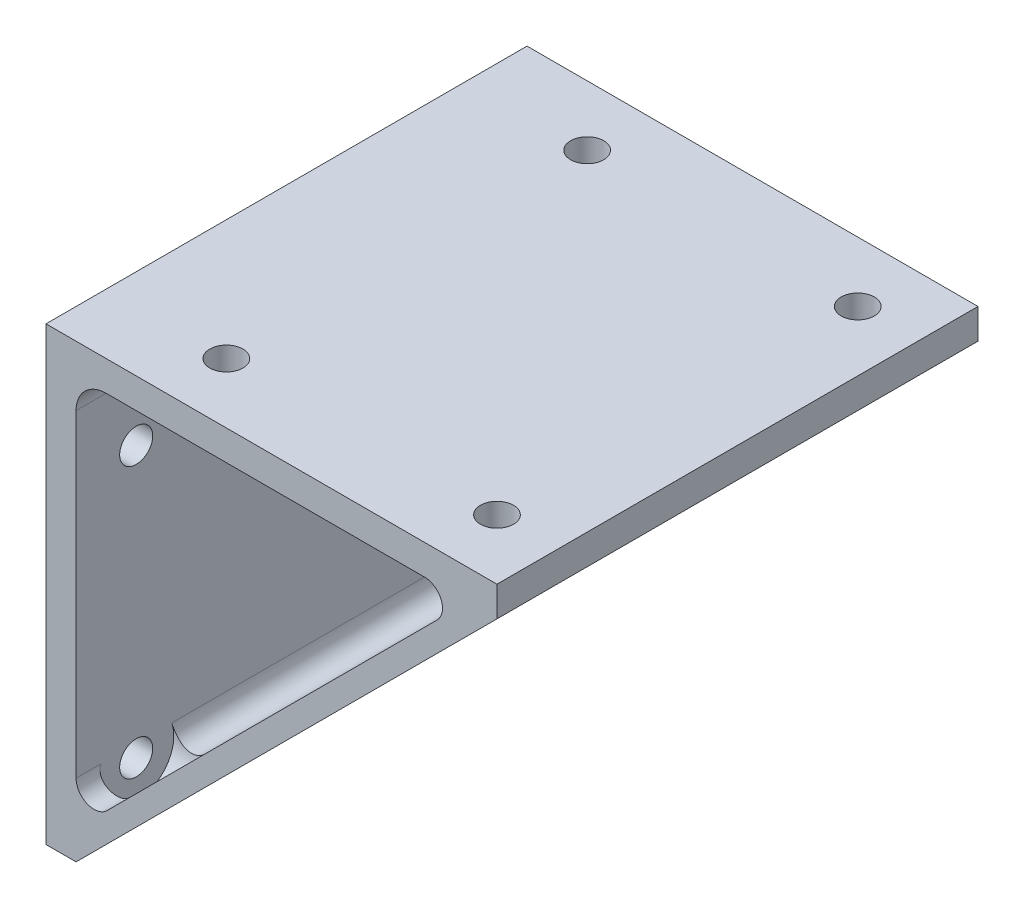
from build123d import *

# Parameters (mm, degrees)
BOSS_EXTRU_1_DEPTH      = 80
CONG_1_R                = 3
CONG_2_R                = 5
ENL_V_MAT_EXTRU_1_REACH = 119.218
ESQUISSE2_R             = 2.75
ENL_V_MAT_EXTRU_2_REACH = 116.084
ESQUISSE3_R             = 6.25
ENL_V_MAT_EXTRU_3_REACH = 125.629
ESQUISSE4_R             = 2.75
ENL_V_MAT_EXTRU_4_REACH = 122.661
ESQUISSE5_R             = 6.25
ENL_V_START             = -3.408092413
ENL_V_MAT_EXTRU_5_DEPTH = 3.408092413


# Read off the part's stored shape, not the designer's step: Enlèv. mat.-Extru.5
with BuildPart() as part:
    # Esquisse1 → Boss.-Extru.1 (new body)
    with BuildSketch(Plane.XY):
        Polygon((-33.585720943, 17.910660079), (-33.585720943, -57.089339921), (-28.585720943, -57.089339921), (41.414279057, 12.910660079), (41.414279057, 17.910660079), align=None)
        Polygon((-28.585720943, -52.269569409), (-28.585720943, 12.910660079), (36.594508545, 12.910660079), align=None, mode=Mode.SUBTRACT)
    extrude(amount=BOSS_EXTRU_1_DEPTH)

    # Congé1
    cong_1_edges = [part.edges().sort_by_distance(p)[0] for p in [
        (-28.585720943, -52.269569409, 40),
        (36.594508545, 12.910660079, 40),
    ]]
    fillet(cong_1_edges, radius=CONG_1_R)

    # Congé2
    cong_2_edges = [part.edges().sort_by_distance(p)[0] for p in [
        (-28.585720943, 12.910660079, 40),
    ]]
    fillet(cong_2_edges, radius=CONG_2_R)

    # Esquisse2 → Enlèv. mat.-Extru.1 (cut, up to next)
    with BuildSketch(Plane(origin=(0, 17.910660079, 0), x_dir=(1, 0, 0), z_dir=(0, 1, 0)), mode=Mode.PRIVATE) as enl_v_mat_extru_1_sk1:
        with Locations(Location((-13.585720943, -10, 0), (0, 0, 180))):
            Circle(ESQUISSE2_R)
    enl_v_mat_extru_1_tool1 = extrude(enl_v_mat_extru_1_sk1.sketch, amount=-ENL_V_MAT_EXTRU_1_REACH, mode=Mode.PRIVATE) & part.part
    # Esquisse2 → Enlèv. mat.-Extru.1 (cut, up to next)
    with BuildSketch(Plane(origin=(0, 17.910660079, 0), x_dir=(1, 0, 0), z_dir=(0, 1, 0)), mode=Mode.PRIVATE) as enl_v_mat_extru_1_sk2:
        with Locations(Location((31.414279057, -10, 0), (0, 0, 180))):
            Circle(ESQUISSE2_R)
    enl_v_mat_extru_1_tool2 = extrude(enl_v_mat_extru_1_sk2.sketch, amount=-ENL_V_MAT_EXTRU_1_REACH, mode=Mode.PRIVATE) & part.part
    # Esquisse2 → Enlèv. mat.-Extru.1 (cut, up to next)
    with BuildSketch(Plane(origin=(0, 17.910660079, 0), x_dir=(1, 0, 0), z_dir=(0, 1, 0)), mode=Mode.PRIVATE) as enl_v_mat_extru_1_sk3:
        with Locations(Location((31.414279057, -70, 0), (0, 0, 180))):
            Circle(ESQUISSE2_R)
    enl_v_mat_extru_1_tool3 = extrude(enl_v_mat_extru_1_sk3.sketch, amount=-ENL_V_MAT_EXTRU_1_REACH, mode=Mode.PRIVATE) & part.part
    # Esquisse2 → Enlèv. mat.-Extru.1 (cut, up to next)
    with BuildSketch(Plane(origin=(0, 17.910660079, 0), x_dir=(1, 0, 0), z_dir=(0, 1, 0)), mode=Mode.PRIVATE) as enl_v_mat_extru_1_sk4:
        with Locations(Location((-13.585720943, -70, 0), (0, 0, 180))):
            Circle(ESQUISSE2_R)
    enl_v_mat_extru_1_tool4 = extrude(enl_v_mat_extru_1_sk4.sketch, amount=-ENL_V_MAT_EXTRU_1_REACH, mode=Mode.PRIVATE) & part.part
    add(enl_v_mat_extru_1_tool1.solids().sort_by_distance((-13.585721, 17.91066, 10))[0], mode=Mode.SUBTRACT)
    add(enl_v_mat_extru_1_tool2.solids().sort_by_distance((31.414279, 17.91066, 10))[0], mode=Mode.SUBTRACT)
    add(enl_v_mat_extru_1_tool3.solids().sort_by_distance((31.414279, 17.91066, 70))[0], mode=Mode.SUBTRACT)
    add(enl_v_mat_extru_1_tool4.solids().sort_by_distance((-13.585721, 17.91066, 70))[0], mode=Mode.SUBTRACT)

    # Enlèv. mat.-Extru.2: up to this plane
    enl_v_mat_extru_2_end = Plane(origin=(-28.585720943, -57.089339921, 80), z_dir=(-0.7071067811865477, 0.7071067811865474, 0))
    # Esquisse3 → Enlèv. mat.-Extru.2 (cut, up to the surface)
    with BuildSketch(Plane.XZ.offset(-12.910660079), mode=Mode.PRIVATE) as enl_v_mat_extru_2_sk1:
        with Locations((-13.585720943, 10)):
            Circle(ESQUISSE3_R)
    enl_v_mat_extru_2_tool1 = split(extrude(enl_v_mat_extru_2_sk1.sketch, amount=ENL_V_MAT_EXTRU_2_REACH, mode=Mode.PRIVATE), bisect_by=enl_v_mat_extru_2_end, keep=Keep.BOTH, mode=Mode.PRIVATE)
    add(enl_v_mat_extru_2_tool1.solids().sort_by_distance((-13.585721, 12.91066, 10))[0], mode=Mode.SUBTRACT)
    # Esquisse3 → Enlèv. mat.-Extru.2 (cut, up to the surface)
    with BuildSketch(Plane.XZ.offset(-12.910660079), mode=Mode.PRIVATE) as enl_v_mat_extru_2_sk2:
        with Locations((-13.585720943, 70)):
            Circle(ESQUISSE3_R)
    enl_v_mat_extru_2_tool2 = split(extrude(enl_v_mat_extru_2_sk2.sketch, amount=ENL_V_MAT_EXTRU_2_REACH, mode=Mode.PRIVATE), bisect_by=enl_v_mat_extru_2_end, keep=Keep.BOTH, mode=Mode.PRIVATE)
    add(enl_v_mat_extru_2_tool2.solids().sort_by_distance((-13.585721, 12.91066, 70))[0], mode=Mode.SUBTRACT)
    # Esquisse3 → Enlèv. mat.-Extru.2 (cut, up to the surface)
    with BuildSketch(Plane.XZ.offset(-12.910660079), mode=Mode.PRIVATE) as enl_v_mat_extru_2_sk3:
        with Locations(Location((31.414279057, 10, 0), (0, 0, 109.267913115))):
            Circle(ESQUISSE3_R)
    enl_v_mat_extru_2_tool3 = split(extrude(enl_v_mat_extru_2_sk3.sketch, amount=ENL_V_MAT_EXTRU_2_REACH, mode=Mode.PRIVATE), bisect_by=enl_v_mat_extru_2_end, keep=Keep.BOTH, mode=Mode.PRIVATE)
    add(enl_v_mat_extru_2_tool3.solids().sort_by_distance((31.414279, 12.91066, 10))[0], mode=Mode.SUBTRACT)
    # Esquisse3 → Enlèv. mat.-Extru.2 (cut, up to the surface)
    with BuildSketch(Plane.XZ.offset(-12.910660079), mode=Mode.PRIVATE) as enl_v_mat_extru_2_sk4:
        with Locations(Location((31.414279057, 70, 0), (0, 0, 109.267913115))):
            Circle(ESQUISSE3_R)
    enl_v_mat_extru_2_tool4 = split(extrude(enl_v_mat_extru_2_sk4.sketch, amount=ENL_V_MAT_EXTRU_2_REACH, mode=Mode.PRIVATE), bisect_by=enl_v_mat_extru_2_end, keep=Keep.BOTH, mode=Mode.PRIVATE)
    add(enl_v_mat_extru_2_tool4.solids().sort_by_distance((31.414279, 12.91066, 70))[0], mode=Mode.SUBTRACT)

    # Esquisse4 → Enlèv. mat.-Extru.3 (cut, up to next)
    with BuildSketch(Plane.ZY.offset(33.585720943), mode=Mode.PRIVATE) as enl_v_mat_extru_3_sk1:
        with Locations(Location((10, -47.089339921, 0), (0, 0, 270))):
            Circle(ESQUISSE4_R)
    enl_v_mat_extru_3_tool1 = extrude(enl_v_mat_extru_3_sk1.sketch, amount=-ENL_V_MAT_EXTRU_3_REACH, mode=Mode.PRIVATE) & part.part
    # Esquisse4 → Enlèv. mat.-Extru.3 (cut, up to next)
    with BuildSketch(Plane.ZY.offset(33.585720943), mode=Mode.PRIVATE) as enl_v_mat_extru_3_sk2:
        with Locations(Location((10, -2.089339921, 0), (0, 0, 270))):
            Circle(ESQUISSE4_R)
    enl_v_mat_extru_3_tool2 = extrude(enl_v_mat_extru_3_sk2.sketch, amount=-ENL_V_MAT_EXTRU_3_REACH, mode=Mode.PRIVATE) & part.part
    # Esquisse4 → Enlèv. mat.-Extru.3 (cut, up to next)
    with BuildSketch(Plane.ZY.offset(33.585720943), mode=Mode.PRIVATE) as enl_v_mat_extru_3_sk3:
        with Locations(Location((70, -2.089339921, 0), (0, 0, 270))):
            Circle(ESQUISSE4_R)
    enl_v_mat_extru_3_tool3 = extrude(enl_v_mat_extru_3_sk3.sketch, amount=-ENL_V_MAT_EXTRU_3_REACH, mode=Mode.PRIVATE) & part.part
    # Esquisse4 → Enlèv. mat.-Extru.3 (cut, up to next)
    with BuildSketch(Plane.ZY.offset(33.585720943), mode=Mode.PRIVATE) as enl_v_mat_extru_3_sk4:
        with Locations(Location((70, -47.089339921, 0), (0, 0, 270))):
            Circle(ESQUISSE4_R)
    enl_v_mat_extru_3_tool4 = extrude(enl_v_mat_extru_3_sk4.sketch, amount=-ENL_V_MAT_EXTRU_3_REACH, mode=Mode.PRIVATE) & part.part
    add(enl_v_mat_extru_3_tool1.solids().sort_by_distance((-33.585721, -47.08934, 10))[0], mode=Mode.SUBTRACT)
    add(enl_v_mat_extru_3_tool2.solids().sort_by_distance((-33.585721, -2.08934, 10))[0], mode=Mode.SUBTRACT)
    add(enl_v_mat_extru_3_tool3.solids().sort_by_distance((-33.585721, -2.08934, 70))[0], mode=Mode.SUBTRACT)
    add(enl_v_mat_extru_3_tool4.solids().sort_by_distance((-33.585721, -47.08934, 70))[0], mode=Mode.SUBTRACT)

    # Esquisse5 → Enlèv. mat.-Extru.4 (cut, up to next)
    with BuildSketch(Plane(origin=(-28.585720943, 0, 0), x_dir=(0, 0, -1), z_dir=(1, 0, 0)), mode=Mode.PRIVATE) as enl_v_mat_extru_4_sk1:
        with Locations((-10, -2.089339921)):
            Circle(ESQUISSE5_R)
    enl_v_mat_extru_4_tool1 = extrude(enl_v_mat_extru_4_sk1.sketch, amount=ENL_V_MAT_EXTRU_4_REACH, mode=Mode.PRIVATE) & part.part
    # Esquisse5 → Enlèv. mat.-Extru.4 (cut, up to next)
    with BuildSketch(Plane(origin=(-28.585720943, 0, 0), x_dir=(0, 0, -1), z_dir=(1, 0, 0)), mode=Mode.PRIVATE) as enl_v_mat_extru_4_sk2:
        with Locations((-70, -2.089339921)):
            Circle(ESQUISSE5_R)
    enl_v_mat_extru_4_tool2 = extrude(enl_v_mat_extru_4_sk2.sketch, amount=ENL_V_MAT_EXTRU_4_REACH, mode=Mode.PRIVATE) & part.part
    # Esquisse5 → Enlèv. mat.-Extru.4 (cut, up to next)
    with BuildSketch(Plane(origin=(-28.585720943, 0, 0), x_dir=(0, 0, -1), z_dir=(1, 0, 0)), mode=Mode.PRIVATE) as enl_v_mat_extru_4_sk3:
        with Locations((-10, -47.089339921)):
            Circle(ESQUISSE5_R)
    enl_v_mat_extru_4_tool3 = extrude(enl_v_mat_extru_4_sk3.sketch, amount=ENL_V_MAT_EXTRU_4_REACH, mode=Mode.PRIVATE) & part.part
    # Esquisse5 → Enlèv. mat.-Extru.4 (cut, up to next)
    with BuildSketch(Plane(origin=(-28.585720943, 0, 0), x_dir=(0, 0, -1), z_dir=(1, 0, 0)), mode=Mode.PRIVATE) as enl_v_mat_extru_4_sk4:
        with Locations((-70, -47.089339921)):
            Circle(ESQUISSE5_R)
    enl_v_mat_extru_4_tool4 = extrude(enl_v_mat_extru_4_sk4.sketch, amount=ENL_V_MAT_EXTRU_4_REACH, mode=Mode.PRIVATE) & part.part
    add(enl_v_mat_extru_4_tool1.solids().sort_by_distance((-28.585721, -2.08934, 10))[0], mode=Mode.SUBTRACT)
    add(enl_v_mat_extru_4_tool2.solids().sort_by_distance((-28.585721, -2.08934, 70))[0], mode=Mode.SUBTRACT)
    add(enl_v_mat_extru_4_tool3.solids().sort_by_distance((-28.585721, -47.08934, 10))[0], mode=Mode.SUBTRACT)
    add(enl_v_mat_extru_4_tool4.solids().sort_by_distance((-28.585721, -47.08934, 70))[0], mode=Mode.SUBTRACT)

    # Enlèv. mat.-Extru.5 outline → Enlèv. mat.-Extru.5 (cut)
    with BuildSketch(Plane(origin=(14.251809489, -14.251809489, 0), x_dir=(0, 0, -1), z_dir=(0.7071067811865477, -0.7071067811865474, 0)).offset(ENL_V_START)):
        Polygon((-3.876275643, 15.432562462), (-3.75, 17.200329415), (-3.75, 24.271397227), (-3.876275643, 26.03916418), (-16.123724357, 26.03916418), (-16.25, 24.271397227), (-16.25, 17.200329415), (-16.123724357, 15.432562462), align=None)
        Polygon((-3.75, -46.439280892), (-3.75, -39.36821308), (-3.876275643, -37.600446127), (-16.123724357, -37.600446127), (-16.25, -39.36821308), (-16.25, -46.439280892), (-16.123724357, -48.207047845), (-3.876275643, -48.207047845), align=None)
        Polygon((-76.123724357, -37.600446127), (-76.25, -39.36821308), (-76.25, -46.439280892), (-76.123724357, -48.207047845), (-63.876275643, -48.207047845), (-63.75, -46.439280892), (-63.75, -39.36821308), (-63.876275643, -37.600446127), align=None)
        Polygon((-63.876275643, 15.432562462), (-63.75, 17.200329415), (-63.75, 24.271397227), (-63.876275643, 26.03916418), (-76.123724357, 26.03916418), (-76.25, 24.271397227), (-76.25, 17.200329415), (-76.123724357, 15.432562462), align=None)
    extrude(amount=ENL_V_MAT_EXTRU_5_DEPTH, mode=Mode.SUBTRACT)


solid = part.part
